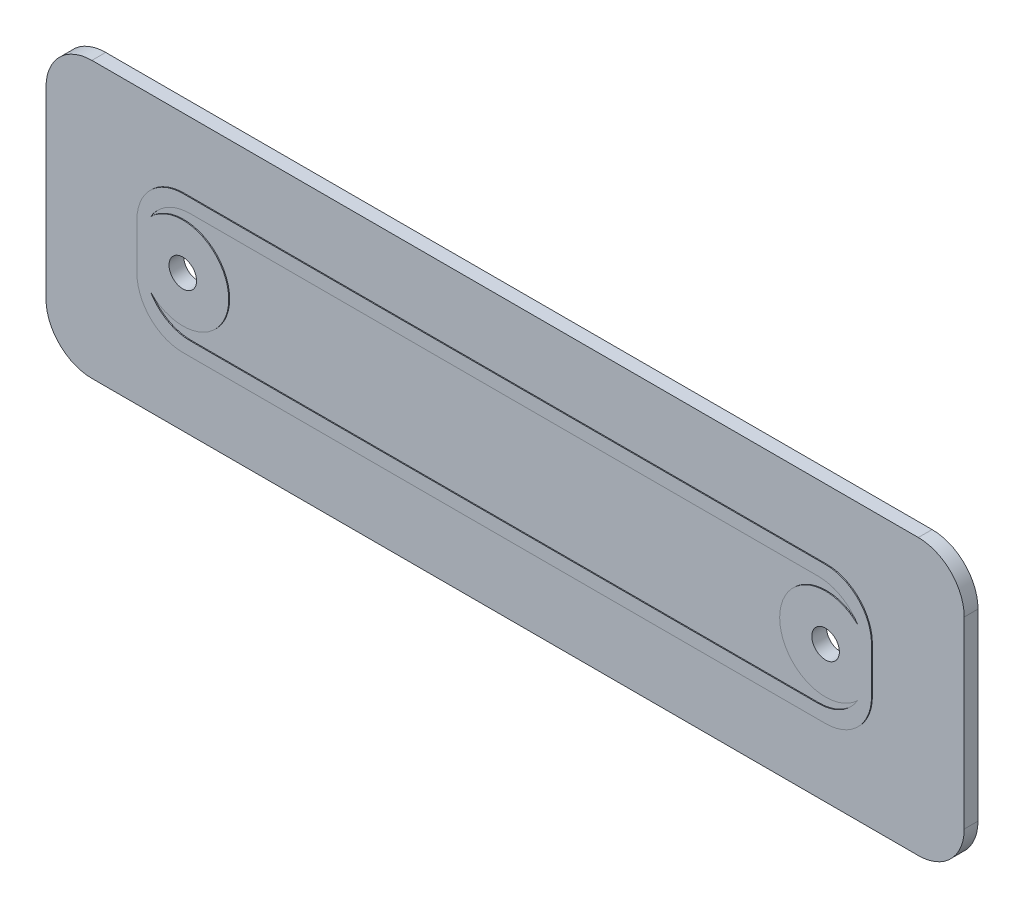
from build123d import *

# Parameters (mm, degrees)
SKETCH1_W               = 100
SKETCH1_H               = 30
BOSS_EXTRUDE1_DEPTH     = 1.5
SKETCH2_W               = 80
SKETCH2_H               = 15
SKETCH2_W_2             = 77
SKETCH2_H_2             = 12
EXTRUDE_THIN1_DEPTH     = 0.1
SKETCH3_R               = 5
BOSS_EXTRUDE2_DEPTH     = 0.1
CUT_EXTRUDE1_DEPTH      = 53.226047141
CUT_EXTRUDE1_DEPTH_BACK = 53.226047141
SKETCH4_R               = 1.5
FILLET1_R               = 5


with BuildPart() as part:
    # Sketch1 → Boss-Extrude1 (new body)
    with BuildSketch(Plane.XY):
        Rectangle(SKETCH1_W, SKETCH1_H)
    extrude(amount=BOSS_EXTRUDE1_DEPTH)

    # Sketch2 → Extrude-Thin1 (add)
    with BuildSketch(Plane.XY.offset(1.5)):
        Rectangle(SKETCH2_W, SKETCH2_H)
        Rectangle(SKETCH2_W_2, SKETCH2_H_2, mode=Mode.SUBTRACT)
    extrude(amount=EXTRUDE_THIN1_DEPTH)

    # Sketch3 → Boss-Extrude2 (add)
    with BuildSketch(Plane.XY.offset(1.5)):
        with Locations((-35, 0)):
            Circle(SKETCH3_R)
        with Locations((35, 0)):
            Circle(SKETCH3_R)
    extrude(amount=BOSS_EXTRUDE2_DEPTH)

    # Sketch4 → Cut-Extrude1 (cut, two sides: drawn at the far end of the back side and taken through both)
    with BuildSketch(Plane.XY.offset(1.6).offset(-CUT_EXTRUDE1_DEPTH_BACK)):
        with Locations((-35, 0)):
            Circle(SKETCH4_R)
        with Locations((35, 0)):
            Circle(SKETCH4_R)
    extrude(amount=CUT_EXTRUDE1_DEPTH + CUT_EXTRUDE1_DEPTH_BACK, mode=Mode.SUBTRACT)

    # Fillet1
    # the kernel refuses this fillet: 5 mm, written as the material it adds along each edge
    with BuildSketch(Plane(origin=(38.5, -6, 1.5), x_dir=(0, 1, 0), z_dir=(0, 0, 1))) as fillet1_piece_1:
        with BuildLine():
            CenterArc((5, 4.288522873), FILLET1_R, 180, 59.059821395)
            Line((0, 4.288522873), (0, 0))
            Line((0, 0), (2.429285786, 0))
        make_face()
    extrude(amount=0.1)
    with BuildSketch(Plane(origin=(38.5, 6, 1.5), x_dir=(0, -1, 0), z_dir=(0, 0, 1))) as fillet1_piece_2:
        with BuildLine():
            CenterArc((5, -4.288522873), FILLET1_R, 120.940178605, 59.059821395)
            Line((0, -4.288522873), (0, 0))
            Line((0, 0), (2.429285786, 0))
        make_face()
    extrude(amount=0.1)
    with BuildSketch(Plane(origin=(-38.5, -6, 1.5), x_dir=(1, 0, 0), z_dir=(0, 0, 1))) as fillet1_piece_3:
        with BuildLine():
            CenterArc((4.288522873, 5), FILLET1_R, 210.940178605, 59.059821395)
            Line((0, 2.429285786), (0, 0))
            Line((0, 0), (4.288522873, 0))
        make_face()
    extrude(amount=0.1)
    with BuildSketch(Plane(origin=(-38.5, 6, 1.5), x_dir=(1, 0, 0), z_dir=(0, 0, 1))) as fillet1_piece_4:
        with BuildLine():
            CenterArc((4.288522873, -5), FILLET1_R, 90, 59.059821395)
            Line((0, -2.429285786), (0, 0))
            Line((0, 0), (4.288522873, 0))
        make_face()
    extrude(amount=0.1)
    # the kernel refuses this fillet: 5 mm, written as the material it takes off along each edge
    with BuildSketch(Plane(origin=(40, 7.5, 1.5), x_dir=(0, -1, 0), z_dir=(0, 0, 1)), Plane(origin=(40, -7.5, 1.5), x_dir=(-1, 0, 0), z_dir=(0, 0, 1)), Plane(origin=(-40, 7.5, 1.5), x_dir=(1, 0, 0), z_dir=(0, 0, 1))) as fillet1_2_piece_1:
        with BuildLine():
            CenterArc((FILLET1_R, -FILLET1_R), FILLET1_R, 90, 90)
            Line((0, -FILLET1_R), (0, 0))
            Line((0, 0), (FILLET1_R, 0))
        make_face()
    extrude(amount=12.6, mode=Mode.SUBTRACT)
    with BuildSketch(Plane(origin=(-40, -7.5, 1.5), x_dir=(1, 0, 0), z_dir=(0, 0, 1))) as fillet1_2_piece_2:
        with BuildLine():
            CenterArc((FILLET1_R, FILLET1_R), FILLET1_R, 180, 90)
            Line((0, FILLET1_R), (0, 0))
            Line((0, 0), (FILLET1_R, 0))
        make_face()
    extrude(amount=12.6, mode=Mode.SUBTRACT)
    with BuildSketch(Plane(origin=(-50, 15, -12.5), x_dir=(1, 0, 0), z_dir=(0, 0, 1)), Plane(origin=(-50, -15, -12.5), x_dir=(0, 1, 0), z_dir=(0, 0, 1))) as fillet1_2_piece_3:
        with BuildLine():
            CenterArc((FILLET1_R, -FILLET1_R), FILLET1_R, 90, 90)
            Line((0, -FILLET1_R), (0, 0))
            Line((0, 0), (FILLET1_R, 0))
        make_face()
    extrude(amount=26.5, mode=Mode.SUBTRACT)
    with BuildSketch(Plane(origin=(50, -15, -12.5), x_dir=(0, 1, 0), z_dir=(0, 0, 1)), Plane(origin=(50, 15, -12.5), x_dir=(-1, 0, 0), z_dir=(0, 0, 1))) as fillet1_2_piece_4:
        with BuildLine():
            CenterArc((FILLET1_R, FILLET1_R), FILLET1_R, 180, 90)
            Line((0, FILLET1_R), (0, 0))
            Line((0, 0), (FILLET1_R, 0))
        make_face()
    extrude(amount=26.5, mode=Mode.SUBTRACT)


solid = part.part
